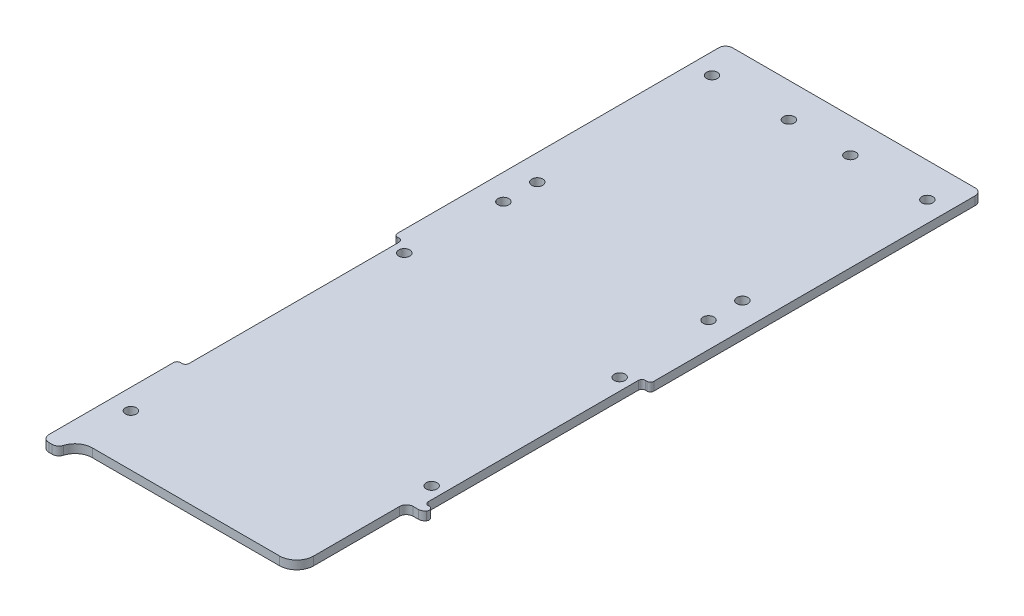
from build123d import *

# Parameters (mm, degrees)
SKETCH1_R               = 2.032
BOSS_EXTRUDE1_DEPTH     = 3.175
FILLET1_R               = 2.54
FILLET2_R               = 2.54
FILLET3_R               = 6.35
CUT_EXTRUDE1_DEPTH      = 136.673215063
FILLET4_R               = 6.35
FILLET5_R               = 2.54
SKETCH3_R               = 2.032
CUT_EXTRUDE2_DEPTH      = 136.673215063
CUT_EXTRUDE3_DEPTH      = 136.673215063
CUT_EXTRUDE3_DEPTH_BACK = 136.673215063
SKETCH4_W               = 3.175
SKETCH4_H               = 80.645
FILLET6_R               = 1.27


with BuildPart() as part:
    # Sketch1 → Boss-Extrude1 (new body)
    with BuildSketch(Plane(origin=(0, 0, 0), x_dir=(1, 0, 0), z_dir=(0, 1, 0))):
        Polygon((47.625, 127), (-47.625, 127), (-47.625, -127), (-41.275, -127), (-41.275, -120.65), (41.275, -120.65), (41.275, -127), (47.625, -127), align=None)
        with Locations((-39.999684148, -101.6)):
            Circle(SKETCH1_R, mode=Mode.SUBTRACT)
        with Locations((39.999684148, -69.85)):
            Circle(SKETCH1_R, mode=Mode.SUBTRACT)
        with Locations((-39.999684148, 0)):
            Circle(SKETCH1_R, mode=Mode.SUBTRACT)
        with Locations((-39.999684148, 114.3)):
            Circle(SKETCH1_R, mode=Mode.SUBTRACT)
        with Locations((-11.424684148, 114.3)):
            Circle(SKETCH1_R, mode=Mode.SUBTRACT)
        with Locations((39.999684148, 0)):
            Circle(SKETCH1_R, mode=Mode.SUBTRACT)
        with Locations((11.424684148, 114.3)):
            Circle(SKETCH1_R, mode=Mode.SUBTRACT)
        with Locations((39.999684148, 114.3)):
            Circle(SKETCH1_R, mode=Mode.SUBTRACT)
    extrude(amount=BOSS_EXTRUDE1_DEPTH)

    # Fillet1
    fillet1_edges = [part.edges().sort_by_distance(p)[0] for p in [
        (-47.625, 1.5875, -127),
        (47.625, 1.5875, -127),
        (47.625, 1.5875, 127),
        (-47.625, 1.5875, 127),
    ]]
    fillet(fillet1_edges, radius=FILLET1_R)

    # Fillet2
    fillet2_edges = [part.edges().sort_by_distance(p)[0] for p in [
        (41.275, 1.5875, 127),
        (-41.275, 1.5875, 127),
    ]]
    fillet(fillet2_edges, radius=FILLET2_R)

    # Fillet3
    fillet3_edges = [part.edges().sort_by_distance(p)[0] for p in [
        (41.275, 1.5875, 120.65),
        (-41.275, 1.5875, 120.65),
    ]]
    fillet(fillet3_edges, radius=FILLET3_R)

    # Sketch2 → Cut-Extrude1 (cut, through all)
    with BuildSketch(Plane.XZ):
        with BuildLine():
            Line((40.64508, 123.578690235), (40.64508, 79.88808))
            Line((40.64508, 79.88808), (47.625, 79.88808))
            Line((47.625, 79.88808), (47.625, 124.46))
            ThreePointArc((47.625, 124.46), (46.881051224, 126.256051224), (45.085, 127))
            Line((45.085, 127), (43.815, 127))
            ThreePointArc((43.815, 127), (42.297059666, 126.496530663), (41.380880287, 125.185714286))
            ThreePointArc((41.380880287, 125.185714286), (41.069166069, 124.356476684), (40.64508, 123.578690235))
        make_face()
    extrude(amount=-CUT_EXTRUDE1_DEPTH, mode=Mode.SUBTRACT)

    # Fillet4
    fillet4_edges = [part.edges().sort_by_distance(p)[0] for p in [
        (40.64508, 1.5875, 123.578690235),
    ]]
    fillet(fillet4_edges, radius=FILLET4_R)

    # Fillet5
    fillet5_edges = [part.edges().sort_by_distance(p)[0] for p in [
        (47.625, 1.5875, 79.88808),
        (40.64508, 1.5875, 79.88808),
    ]]
    fillet(fillet5_edges, radius=FILLET5_R)

    # Sketch3 → Cut-Extrude2 (cut, through all)
    with BuildSketch(Plane.XZ):
        with Locations((-38.103185183, -34.913768806)):
            Circle(SKETCH3_R)
        with Locations((-38.103185183, -47.490173279)):
            Circle(SKETCH3_R)
        with Locations((38.103185183, -47.490173279)):
            Circle(SKETCH3_R)
        with Locations((38.103185183, -34.913768806)):
            Circle(SKETCH3_R)
    extrude(amount=-CUT_EXTRUDE2_DEPTH, mode=Mode.SUBTRACT)

    # Sketch4 → Cut-Extrude3 (cut, two sides: drawn at the far end of the back side and taken through both)
    with BuildSketch(Plane(origin=(0, 3.175, 0), x_dir=(1, 0, 0), z_dir=(0, 1, 0)).offset(-CUT_EXTRUDE3_DEPTH_BACK)):
        with Locations((-46.0375, -36.5125)):
            Rectangle(SKETCH4_W, SKETCH4_H)
        with Locations((46.0375, -36.5125)):
            Rectangle(SKETCH4_W, SKETCH4_H)
    extrude(amount=CUT_EXTRUDE3_DEPTH + CUT_EXTRUDE3_DEPTH_BACK, mode=Mode.SUBTRACT)

    # Fillet6
    fillet6_edges = [part.edges().sort_by_distance(p)[0] for p in [
        (-44.45, 1.5875, -3.81),
        (-47.625, 1.5875, -3.81),
        (-47.625, 1.5875, 76.835),
        (-44.45, 1.5875, 76.835),
        (44.45, 1.5875, 76.835),
        (47.625, 1.5875, 76.835),
        (44.45, 1.5875, -3.81),
        (47.625, 1.5875, -3.81),
    ]]
    fillet(fillet6_edges, radius=FILLET6_R)


solid = part.part
